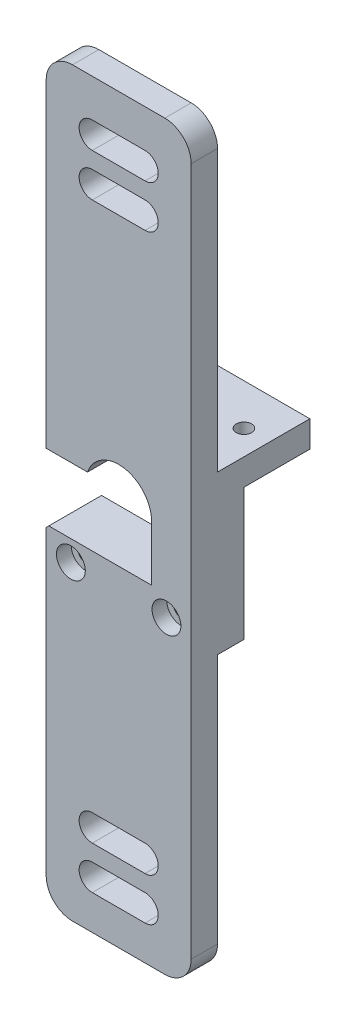
from build123d import *

# Parameters (mm, degrees)
BOSS_EXTRUDE1_DEPTH                                = 5.080000000000001
SKETCH2_W                                          = 5.079999999999998
SKETCH2_H                                          = 0.5079999999999831
BOSS_EXTRUDE2_DEPTH                                = 17.907000000000004
BOSS_EXTRUDE3_DEPTH                                = 1.9049999999999987
BOSS_EXTRUDE4_DEPTH                                = 17.779999999999998
SKETCH5_W                                          = 20.31999999999999
SKETCH5_H                                          = 22.859999999999992
BOSS_EXTRUDE5_DEPTH                                = 63.1505057547775
BOSS_EXTRUDE6_DEPTH                                = 10.03299999999999
BOSS_EXTRUDE7_DEPTH                                = 5.079999999999997
SKETCH8_W                                          = 22.859999999999992
SKETCH8_H                                          = 80.6430229523153
BOSS_EXTRUDE8_DEPTH                                = 7.619999999999997
CUT_EXTRUDE1_DEPTH                                 = 12.699999999999996
CUT_EXTRUDE2_DEPTH                                 = 12.699999999999998
BOSS_EXTRUDE9_DEPTH                                = 5.079999999999997
BOSS_EXTRUDE10_DEPTH                               = 62.23197704768469
SKETCH13_W                                         = 9.524999999999991
SKETCH13_H                                         = 12.699999999999998
CUT_EXTRUDE3_DEPTH                                 = 2.381494245222503
SKETCH14_W                                         = 17.779999999999994
SKETCH14_H                                         = 59.05499999999999
CUT_EXTRUDE4_DEPTH                                 = 100.64847640581364
SKETCH15_W                                         = 5.079999999999998
SKETCH15_H                                         = 53.339999999999996
CUT_EXTRUDE5_DEPTH                                 = 100.64847640581364
CUT_EXTRUDE6_DEPTH                                 = 93.34611808300336
CUT_EXTRUDE7_DEPTH                                 = 94.45724543875664
CUT_EXTRUDE8_DEPTH                                 = 93.34611808300336
CUT_EXTRUDE9_DEPTH                                 = 93.34611808300336
CBORE_FOR_M2_5_HEX_HEAD_MACHINE_SCREW1_D           = 2.9464
CBORE_FOR_M2_5_HEX_HEAD_MACHINE_SCREW1_DEPTH       = 22.86
CBORE_FOR_M2_5_HEX_HEAD_MACHINE_SCREW1_CBORE_D     = 5.55752
CBORE_FOR_M2_5_HEX_HEAD_MACHINE_SCREW1_CBORE_DEPTH = 2.8448
M2_5_CLEARANCE_HOLE1_D                             = 2.9464
M2_5_CLEARANCE_HOLE1_DEPTH                         = 83.82
M2_5_CLEARANCE_HOLE2_D                             = 2.9464
M2_5_CLEARANCE_HOLE2_DEPTH                         = 64.135
FILLET2_R                                          = 2.540000000000001
CHAMFER2_SIZE                                      = 0.938019803
FILLET3_R                                          = 5.079999999999999


with BuildPart() as part:
    # Sketch1 → Boss-Extrude1 (new body)
    with BuildSketch(Plane.XY.offset(33.654999999999994)):
        Polygon((-13.96999999999999, 9.810505754777516), (-13.461999999999998, 9.810505754777516), (-13.461999999999998, 10.3185057547775), align=None)
    extrude(amount=-BOSS_EXTRUDE1_DEPTH)

    # Sketch2 → Boss-Extrude2 (add)
    with BuildSketch(Plane(origin=(-13.461999999999998, 0, 0), x_dir=(0, 0, -1), z_dir=(1, 0, 0))):
        with Locations((-31.114999999999995, 10.064505754777507)):
            Rectangle(SKETCH2_W, SKETCH2_H)
    extrude(amount=BOSS_EXTRUDE2_DEPTH)

    # Sketch3 → Boss-Extrude3 (add)
    with BuildSketch(Plane(origin=(4.445000000000005, 0, 0), x_dir=(0, 0, -1), z_dir=(1, 0, 0))):
        Polygon((-28.574999999999996, 9.810505754777516), (-33.654999999999994, 9.810505754777516), (-33.654999999999994, 10.3185057547775), (-29.083000000000002, 10.3185057547775), (-28.574999999999996, 10.826505754777498), align=None)
    extrude(amount=BOSS_EXTRUDE3_DEPTH)

    # Sketch4 → Boss-Extrude4 (add)
    with BuildSketch(Plane(origin=(0, 0, 28.574999999999996), x_dir=(-1, 0, 0), z_dir=(0, 0, -1))):
        with BuildLine():
            Line((-6.3500000000000005, 9.810505754777516), (-6.349999999999998, 27.303022952315306))
            Line((-6.349999999999998, 27.303022952315306), (3.93700000000001, 27.303022952315306))
            Line((3.93700000000001, 27.303022952315306), (3.93700000000001, 23.0185057547775))
            ThreePointArc((3.93700000000001, 23.0185057547775), (-2.14e-15, 25.399999999999995), (-3.9370000000000167, 23.0185057547775))
            Line((-3.9370000000000167, 23.0185057547775), (-4.445000000000012, 23.0185057547775))
            Line((-4.445000000000012, 23.0185057547775), (-4.445000000000001, 10.3185057547775))
            Line((-4.445000000000001, 10.3185057547775), (13.46200000000004, 10.3185057547775))
            Line((13.46200000000004, 10.3185057547775), (13.969999999999992, 9.810505754777516))
            Line((13.969999999999992, 9.810505754777516), (-6.3500000000000005, 9.810505754777516))
        make_face()
    extrude(amount=BOSS_EXTRUDE4_DEPTH)

    # Sketch5 → Boss-Extrude5 (add)
    with BuildSketch(Plane.XZ.offset(-9.810505754777516)):
        with Locations((-3.8099999999999947, 22.224999999999998)):
            Rectangle(SKETCH5_W, SKETCH5_H)
    extrude(amount=BOSS_EXTRUDE5_DEPTH)

    # Sketch6 → Boss-Extrude6 (add)
    with BuildSketch(Plane.ZY.offset(3.93700000000001)):
        Polygon((28.575, 23.0185057547775), (10.795, 23.0185057547775), (10.794999999999998, 27.303022952315306), (28.575, 27.303022952315306), align=None)
    extrude(amount=BOSS_EXTRUDE6_DEPTH)

    # Sketch7 → Boss-Extrude7 (add)
    with BuildSketch(Plane.XY.offset(28.574999999999996)):
        with BuildLine():
            Line((0.15844430213195376, 27.303022952315306), (6.3500000000000005, 27.303022952315306))
            Line((6.3500000000000005, 27.303022952315306), (6.3500000000000005, 20.955000000000002))
            ThreePointArc((6.3500000000000005, 20.955000000000002), (4.545801432010527, 25.38875566994067), (0.15844430213195376, 27.303022952315306))
        make_face()
    extrude(amount=BOSS_EXTRUDE7_DEPTH)

    # Sketch8 → Boss-Extrude8 (add)
    with BuildSketch(Plane(origin=(6.350000000000003, 0, 0), x_dir=(0, 0, -1), z_dir=(1, 0, 0))):
        with Locations((-22.224999999999998, -13.018488523842345)):
            Rectangle(SKETCH8_W, SKETCH8_H)
    extrude(amount=BOSS_EXTRUDE8_DEPTH)

    # Sketch9 → Cut-Extrude1 (cut)
    with BuildSketch(Plane(origin=(0, 0, 10.794999999999998), x_dir=(-1, 0, 0), z_dir=(0, 0, -1))):
        Polygon((13.97, 25.4), (4.44500000000001, 25.4), (4.445000000000009, 23.526505754777506), (3.9369999999999985, 23.0185057547775), (13.97, 23.0185057547775), align=None)
    extrude(amount=-CUT_EXTRUDE1_DEPTH, mode=Mode.SUBTRACT)

    # Sketch10 → Cut-Extrude2 (cut)
    with BuildSketch(Plane(origin=(0, 0, 10.794999999999998), x_dir=(-1, 0, 0), z_dir=(0, 0, -1))):
        Polygon((-4.445000000000001, 10.3185057547775), (-4.44500000000001, 23.018505754777497), (-13.97, 23.018505754777497), (-13.97, -53.339999999999996), (13.969999999999992, -53.339999999999996), (13.970000000000004, 9.81050575477752), (13.46200000000004, 10.3185057547775), align=None)
    extrude(amount=-CUT_EXTRUDE2_DEPTH, mode=Mode.SUBTRACT)

    # Sketch11 → Boss-Extrude9 (add)
    with BuildSketch(Plane.XY.offset(28.574999999999996)):
        with BuildLine():
            Line((-6.005367932108752, 23.0185057547775), (-13.97, 23.0185057547775))
            Line((-13.97, 23.0185057547775), (-13.97, 27.303022952315306))
            Line((-13.97, 27.303022952315306), (-0.15844430213195376, 27.303022952315306))
            ThreePointArc((-0.15844430213195376, 27.303022952315306), (-3.7533208254481982, 26.077019404615417), (-6.005367932108752, 23.0185057547775))
        make_face()
    extrude(amount=BOSS_EXTRUDE9_DEPTH)

    # Sketch12 → Boss-Extrude10 (add)
    with BuildSketch(Plane(origin=(0, 27.303022952315306, 0), x_dir=(-1, 0, 0), z_dir=(0, 1, 0))):
        Polygon((-13.97, 33.654999999999994), (13.97, 33.654999999999994), (13.97, 10.794999999999998), (-13.97, 10.795), align=None)
    extrude(amount=BOSS_EXTRUDE10_DEPTH)

    # Sketch13 → Cut-Extrude3 (cut)
    with BuildSketch(Plane.XZ.offset(-23.0185057547775)):
        with Locations((9.207500000000005, 17.145)):
            Rectangle(SKETCH13_W, SKETCH13_H)
    extrude(amount=-CUT_EXTRUDE3_DEPTH, mode=Mode.SUBTRACT)

    # Sketch14 → Cut-Extrude4 (cut, through all)
    with BuildSketch(Plane(origin=(13.97, 0, 0), x_dir=(0, 0, -1), z_dir=(1, 0, 0))):
        with Locations((-19.685, 60.0075)):
            Rectangle(SKETCH14_W, SKETCH14_H)
    extrude(amount=-CUT_EXTRUDE4_DEPTH, mode=Mode.SUBTRACT)

    # Sketch15 → Cut-Extrude5 (cut, through all)
    with BuildSketch(Plane(origin=(13.97, 0, 0), x_dir=(0, 0, -1), z_dir=(1, 0, 0))):
        with Locations((-26.034999999999997, -26.669999999999998)):
            Rectangle(SKETCH15_W, SKETCH15_H)
    extrude(amount=-CUT_EXTRUDE5_DEPTH, mode=Mode.SUBTRACT)

    # Sketch16 → Cut-Extrude6 (cut, through all)
    with BuildSketch(Plane(origin=(0, 0, 28.575), x_dir=(-1, 0, 0), z_dir=(0, 0, -1))):
        with BuildLine():
            Line((5.08, -41.592499999999994), (-5.08, -41.592499999999994))
            ThreePointArc((-5.08, -41.592499999999994), (-7.620000000000006, -44.1325), (-5.08, -46.6725))
            Line((-5.08, -46.6725), (5.08, -46.6725))
            ThreePointArc((5.08, -46.6725), (7.619999999999999, -44.1325), (5.08, -41.592499999999994))
        make_face()
    extrude(amount=-CUT_EXTRUDE6_DEPTH, mode=Mode.SUBTRACT)

    # Sketch17 → Cut-Extrude7 (cut, through all)
    with BuildSketch(Plane.XY.offset(33.654999999999994)):
        with BuildLine():
            Line((-5.08, -38.4175), (5.08, -38.4175))
            ThreePointArc((5.08, -38.4175), (7.619999999999999, -35.8775), (5.08, -33.3375))
            Line((5.08, -33.3375), (-5.08, -33.3375))
            ThreePointArc((-5.08, -33.3375), (-7.619999999999999, -35.8775), (-5.08, -38.4175))
        make_face()
    extrude(amount=-CUT_EXTRUDE7_DEPTH, mode=Mode.SUBTRACT)

    # Sketch18 → Cut-Extrude8 (cut, through all)
    with BuildSketch(Plane(origin=(0, 0, 28.575), x_dir=(-1, 0, 0), z_dir=(0, 0, -1))):
        with BuildLine():
            Line((5.08, 73.9775), (-5.08, 73.9775))
            ThreePointArc((-5.08, 73.9775), (-7.620000000000006, 71.4375), (-5.08, 68.8975))
            Line((-5.08, 68.8975), (5.08, 68.8975))
            ThreePointArc((5.08, 68.8975), (7.620000000000006, 71.4375), (5.08, 73.9775))
        make_face()
    extrude(amount=-CUT_EXTRUDE8_DEPTH, mode=Mode.SUBTRACT)

    # Sketch19 → Cut-Extrude9 (cut, through all)
    with BuildSketch(Plane(origin=(0, 0, 28.575), x_dir=(-1, 0, 0), z_dir=(0, 0, -1))):
        with BuildLine():
            Line((5.08, 82.2325), (-5.08, 82.2325))
            ThreePointArc((-5.08, 82.2325), (-7.620000000000006, 79.6925), (-5.08, 77.1525))
            Line((-5.08, 77.1525), (5.08, 77.1525))
            ThreePointArc((5.08, 77.1525), (7.619999999999992, 79.6925), (5.08, 82.2325))
        make_face()
    extrude(amount=-CUT_EXTRUDE9_DEPTH, mode=Mode.SUBTRACT)

    # CBORE for M2.5 Hex Head Machine Screw1
    with Locations(Plane.XY.offset(33.654999999999994)):
        with Locations((9.2075, 6.35), (-9.2075, 6.35)):
            CounterBoreHole(CBORE_FOR_M2_5_HEX_HEAD_MACHINE_SCREW1_D / 2, CBORE_FOR_M2_5_HEX_HEAD_MACHINE_SCREW1_CBORE_D / 2, CBORE_FOR_M2_5_HEX_HEAD_MACHINE_SCREW1_CBORE_DEPTH, depth=CBORE_FOR_M2_5_HEX_HEAD_MACHINE_SCREW1_DEPTH)

    # M2.5 Clearance Hole1
    with Locations(Plane(origin=(0, 30.48, 0), x_dir=(1, 0, 0), z_dir=(0, 1, 0))):
        with Locations((9.2075, -18.7325)):
            Hole(M2_5_CLEARANCE_HOLE1_D / 2, depth=M2_5_CLEARANCE_HOLE1_DEPTH)

    # M2.5 Clearance Hole2
    with Locations(Plane(origin=(0, 25.4, 0), x_dir=(-1, 0, 0), z_dir=(0, -1, 0))):
        with Locations((9.2075, -18.7325)):
            Hole(M2_5_CLEARANCE_HOLE2_D / 2, depth=M2_5_CLEARANCE_HOLE2_DEPTH)

    # Fillet2
    fillet2_edges = [part.edges().sort_by_distance(p)[0] for p in [
        (4.445000000000004, 10.3185057547775, 26.289),
    ]]
    fillet(fillet2_edges, radius=FILLET2_R)

    # Chamfer2
    # the kernel refuses this chamfer: 0.938019803 mm, written as the material it adds along each edge
    with BuildSketch(Plane(origin=(3.44e-15, 20.955, 28.574999999999996), x_dir=(0.3476137543318691, 0.9376378180295966, 0), z_dir=(0.9376378180295966, -0.3476137543318691, 0))) as chamfer2_piece_1_section:
        Polygon((6.349999999999995 - CHAMFER2_SIZE, 0), (6.350000000000003, CHAMFER2_SIZE), (6.349999999999995, 0), align=None)
    chamfer2_piece_1 = revolve(axis=Axis((3.44e-15, 20.955, 28.574999999999996), (0, 0, 1)), revolution_arc=113.14940178409387, mode=Mode.PRIVATE)
    chamfer2_piece_1 = split(chamfer2_piece_1, bisect_by=Plane(origin=(-2.526546800118106, 23.0185057547775, 29.032255606191857), z_dir=(0, 1, 0)), keep=Keep.TOP, mode=Mode.PRIVATE)
    add(chamfer2_piece_1)
    with BuildSketch(Plane(origin=(6.350000000000003, 8.4142161862341, 28.574999999999996), x_dir=(0.027495876610586452, 0, 0.9996219169112966), z_dir=(-1.5e-16, 1, 0))) as chamfer2_piece_2:
        Polygon((CHAMFER2_SIZE * 0.999621916411, -CHAMFER2_SIZE * 0.0274958765968), (-CHAMFER2_SIZE * 0.0274958765968, -CHAMFER2_SIZE * 0.999621916411), (0, 0), align=None)
    extrude(amount=12.540783813765902)
    with BuildSketch(Plane(origin=(-2e-15, 20.955, 28.574999999999996), x_dir=(1, 5.6e-16, 0), z_dir=(5.6e-16, -1, 0))) as chamfer2_piece_3:
        Polygon((6.350000000000002 - CHAMFER2_SIZE, 0), (6.350000000000002, CHAMFER2_SIZE), (6.350000000000002, 0), align=None)
    revolve(axis=Axis((-2e-15, 20.955, 28.574999999999996), (0, 0, 1)), revolution_arc=110.34466934043498)

    # Fillet3
    fillet3_edges = [part.edges().sort_by_distance(p)[0] for p in [
        (13.97, -53.339999999999996, 31.114999999999995),
        (13.97, 89.535, 31.114999999999995),
        (-13.97, 89.535, 31.114999999999995),
        (-13.96999999999999, -53.33999999999998, 31.114999999999995),
    ]]
    fillet(fillet3_edges, radius=FILLET3_R)


solid = part.part
